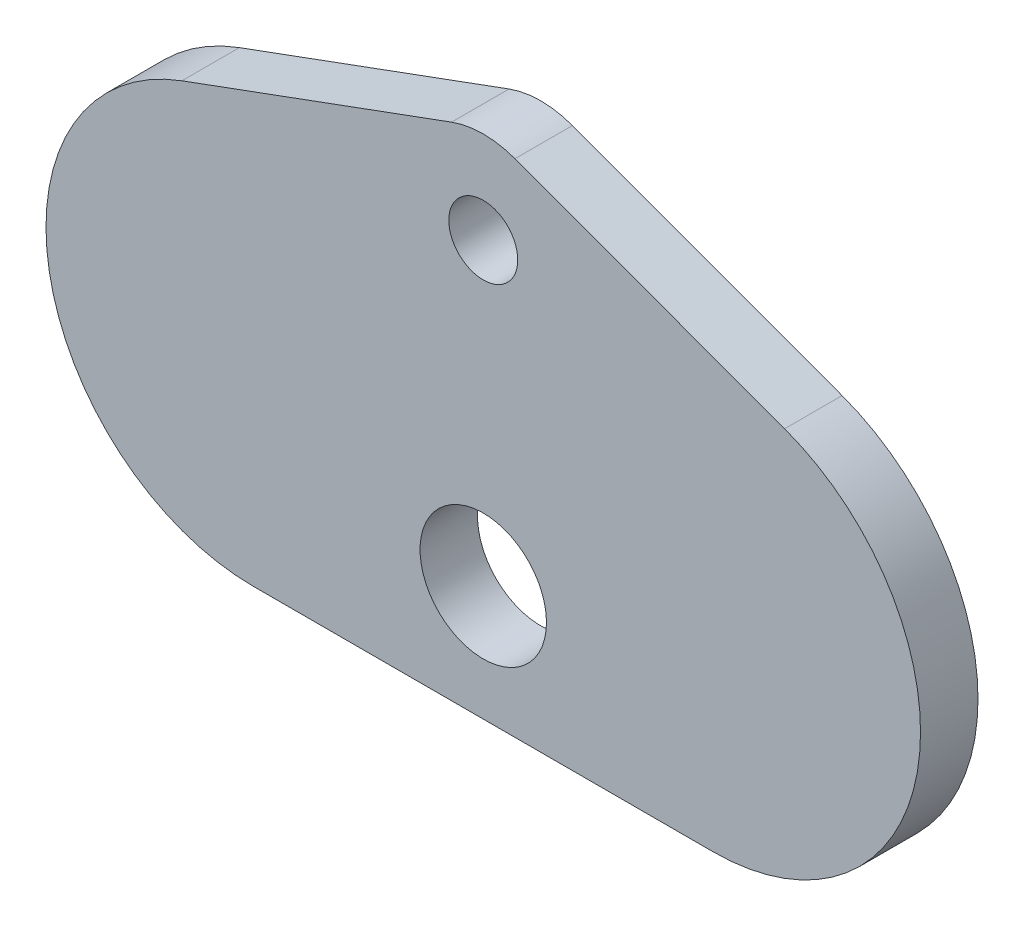
from build123d import *

# Parameters (mm, degrees)
SKETCH1_R           = 6
SKETCH1_R_2         = 11
BOSS_EXTRUDE1_DEPTH = 10


with BuildPart() as part:
    # Sketch1 → Boss-Extrude1 (new body)
    with BuildSketch(Plane.XY):
        with BuildLine():
            ThreePointArc((5.515152575, -0.980576174), (0, 0), (-5.515152575, -0.980576174))
            Line((-5.515152575, -0.980576174), (-52.441839513, -18.212118562))
            ThreePointArc((-52.441839513, -18.212118562), (-75.537667555, -58.413481601), (-40, -88.19))
            Line((-40, -88.19), (40, -88.19))
            ThreePointArc((40, -88.19), (75.537667555, -58.413481601), (52.441839513, -18.212118562))
            Line((52.441839513, -18.212118562), (5.515152575, -0.980576174))
        make_face()
        with Locations((0, -16)):
            Circle(SKETCH1_R, mode=Mode.SUBTRACT)
        with Locations((0, -68.131802206)):
            Circle(SKETCH1_R_2, mode=Mode.SUBTRACT)
    extrude(amount=BOSS_EXTRUDE1_DEPTH)


solid = part.part
